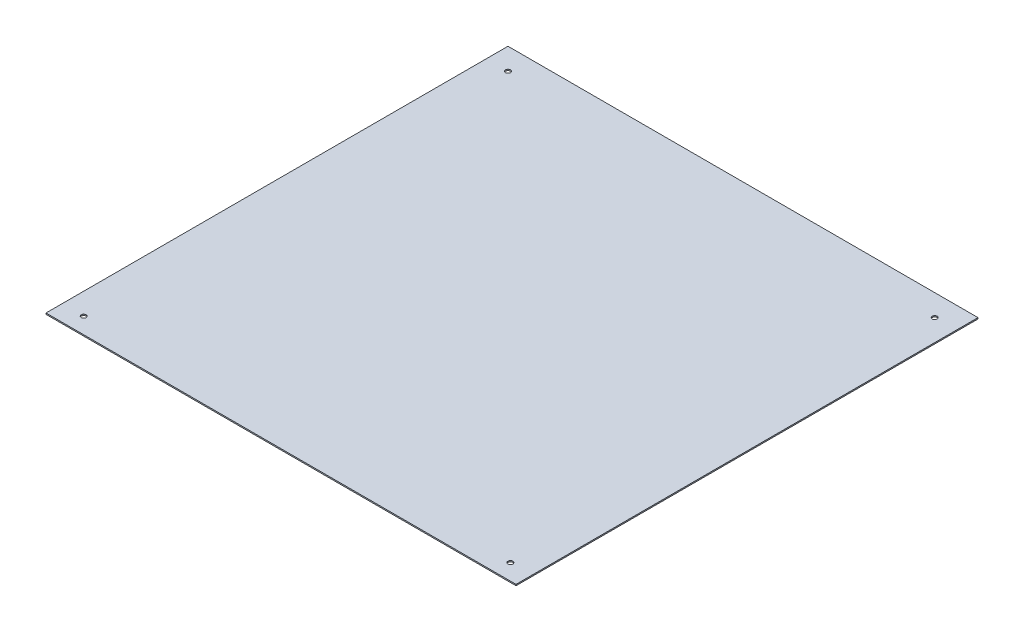
from build123d import *

# Parameters (mm, degrees)
SKETCH1_W           = 380
SKETCH1_H           = 373.5
SKETCH1_R           = 2
BOSS_EXTRUDE1_DEPTH = 1


with BuildPart() as part:
    # Sketch1 → Boss-Extrude1 (new body)
    with BuildSketch(Plane(origin=(0, 0, 0), x_dir=(1, 0, 0), z_dir=(0, 1, 0))):
        Rectangle(SKETCH1_W, SKETCH1_H)
        with Locations((-172.5, -173.75)):
            Circle(SKETCH1_R, mode=Mode.SUBTRACT)
        with Locations((-172.5, 169.25)):
            Circle(SKETCH1_R, mode=Mode.SUBTRACT)
        with Locations((172.5, 169.25)):
            Circle(SKETCH1_R, mode=Mode.SUBTRACT)
        with Locations((172.5, -173.75)):
            Circle(SKETCH1_R, mode=Mode.SUBTRACT)
    extrude(amount=BOSS_EXTRUDE1_DEPTH)


solid = part.part
